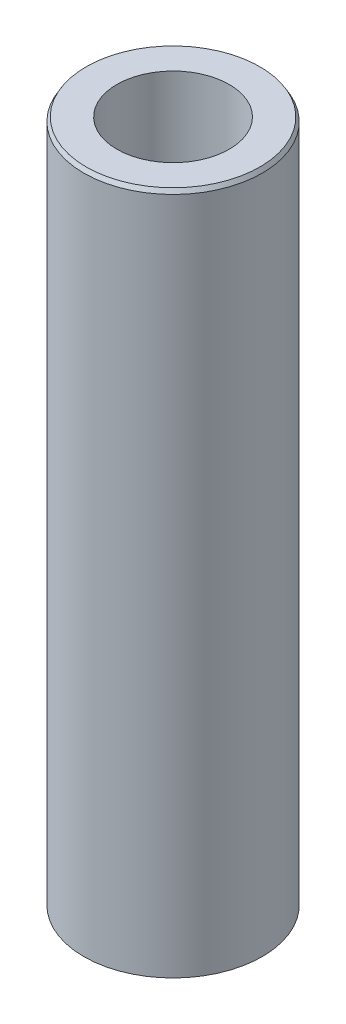
from build123d import *
from OCP.BRepFilletAPI import BRepFilletAPI_MakeChamfer

# Parameters (mm, degrees)
SKETCH1_R           = 52.5
BOSS_EXTRUDE1_DEPTH = 403.04358123
SKETCH2_R           = 33.045058525
CUT_EXTRUDE1_DEPTH  = 410.825119253
CHAMFER1_SIZE       = 2.43567892
CHAMFER1_SIZE2      = 1.40623988


with BuildPart() as part:
    # Sketch1 → Boss-Extrude1 (new body)
    with BuildSketch(Plane(origin=(0, 0, 0), x_dir=(1, 0, 0), z_dir=(0, 1, 0))):
        Circle(SKETCH1_R)
    extrude(amount=BOSS_EXTRUDE1_DEPTH)

    # Sketch2 → Cut-Extrude1 (cut, through all)
    with BuildSketch(Plane(origin=(0, 0, 0), x_dir=(1, 0, 0), z_dir=(0, 1, 0))):
        Circle(SKETCH2_R)
    extrude(amount=CUT_EXTRUDE1_DEPTH, mode=Mode.SUBTRACT)

    # Chamfer1: one chamfer whose edges measure the first distance from different faces: ONE call of the kernel's chamfer builder (chamfer() names one face for all edges)
    chamfer1_edges_1 = [part.edges().sort_by_distance(p)[0] for p in [
        (-52.5, 403.04358123, 0),
    ]]
    chamfer1_side_1 = [part.faces().sort_by_distance(p)[0] for p in [
        (-52.5, 201.521790615, 0),
    ]]
    chamfer1_edges_2 = [part.edges().sort_by_distance(p)[0] for p in [
        (-52.5, 0, 0),
    ]]
    chamfer1_side_2 = [part.faces().sort_by_distance(p)[0] for p in [
        (-51.01507576, 0, 0),
    ]]
    chamfer1 = BRepFilletAPI_MakeChamfer(part.part.solid().wrapped)
    for e in chamfer1_edges_1:
        chamfer1.Add(CHAMFER1_SIZE, CHAMFER1_SIZE2, e.wrapped, chamfer1_side_1[0].wrapped)  # the first distance lies on this face
    for e in chamfer1_edges_2:
        chamfer1.Add(CHAMFER1_SIZE, CHAMFER1_SIZE2, e.wrapped, chamfer1_side_2[0].wrapped)  # the first distance lies on this face
    add(Compound.cast(chamfer1.Shape()), mode=Mode.REPLACE)


solid = part.part
